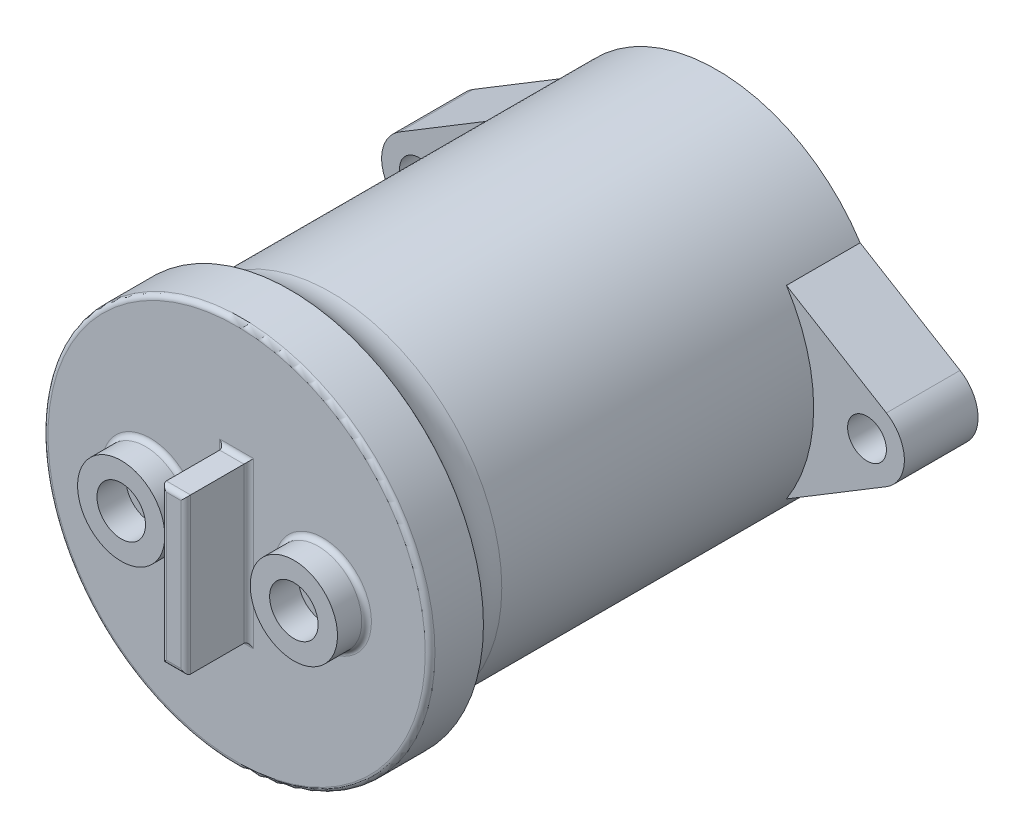
from build123d import *

# Parameters (mm, degrees)
SKETCH2_R           = 17.6
BOSS_EXTRUDE1_DEPTH = 52.5
SKETCH3_R           = 2
BOSS_EXTRUDE2_DEPTH = 7.6
SKETCH4_W           = 2.5
SKETCH4_H           = 16
BOSS_EXTRUDE3_DEPTH = 3.5
CUT_EXTRUDE1_START  = -3
SKETCH5_R           = 17.6
SKETCH5_R_2         = 4.5
SKETCH5_W           = 2.5
SKETCH5_H           = 16
SKETCH5_R_3         = 2.5
CUT_EXTRUDE1_DEPTH  = 3
SKETCH7_R           = 19.95
BOSS_EXTRUDE5_DEPTH = 5.5
FILLET3_R           = 5
FILLET4_R           = 0.5


with BuildPart() as part:
    # Sketch2 → Boss-Extrude1 (new body)
    with BuildSketch(Plane.XY):
        Circle(SKETCH2_R)
    extrude(amount=BOSS_EXTRUDE1_DEPTH)

    # Sketch3 → Boss-Extrude2 (add)
    # profile 1 of 2: a face of its own
    with BuildSketch(Plane.XY):
        with BuildLine():
            Line((-14.793995556, 9.534028294), (-25.095041698, 3.292766105))
            ThreePointArc((-25.095041698, 3.292766105), (-26.95, 0), (-25.095041698, -3.292766105))
            Line((-25.095041698, -3.292766105), (-14.793995556, -9.534028294))
            ThreePointArc((-14.793995556, -9.534028294), (-17.6, 0), (-14.793995556, 9.534028294))
        make_face()
        with Locations(Location((-23.1, 0, 0), (0, 0, 180))):
            Circle(SKETCH3_R, mode=Mode.SUBTRACT)
    # profile 2 of 2: a face of its own
    with BuildSketch(Plane.XY):
        with BuildLine():
            Line((25.095041698, 3.292766105), (14.793995556, 9.534028294))
            ThreePointArc((14.793995556, 9.534028294), (17.6, 0), (14.793995556, -9.534028294))
            Line((14.793995556, -9.534028294), (25.095041698, -3.292766105))
            ThreePointArc((25.095041698, -3.292766105), (26.95, 0), (25.095041698, 3.292766105))
        make_face()
        with Locations(Location((23.1, 0, 0), (0, 0, 180))):
            Circle(SKETCH3_R, mode=Mode.SUBTRACT)
    extrude(amount=BOSS_EXTRUDE2_DEPTH)

    # Sketch4 → Boss-Extrude3 (add)
    with BuildSketch(Plane.XY.offset(52.5)):
        Rectangle(SKETCH4_W, SKETCH4_H)
    extrude(amount=BOSS_EXTRUDE3_DEPTH)

    # Sketch5 → Cut-Extrude1 (cut)
    # profile 1 of 3: a face of its own
    with BuildSketch(Plane.XY.offset(52.5).offset(CUT_EXTRUDE1_START)):
        with Locations(Location((0, 0, 0), (0, 0, 147.200140228))):
            Circle(SKETCH5_R)
        with Locations((-8.9, 0)):
            Circle(SKETCH5_R_2, mode=Mode.SUBTRACT)
        with Locations((8.9, 0)):
            Circle(SKETCH5_R_2, mode=Mode.SUBTRACT)
        Rectangle(SKETCH5_W, SKETCH5_H, mode=Mode.SUBTRACT)
    # profile 2 of 3: a face of its own
    with BuildSketch(Plane.XY.offset(52.5).offset(CUT_EXTRUDE1_START)):
        with Locations((-8.9, 0)):
            Circle(SKETCH5_R_3)
    # profile 3 of 3: a face of its own
    with BuildSketch(Plane.XY.offset(52.5).offset(CUT_EXTRUDE1_START)):
        with Locations((8.9, 0)):
            Circle(SKETCH5_R_3)
    extrude(amount=CUT_EXTRUDE1_DEPTH, mode=Mode.SUBTRACT)

    # Sketch7 → Boss-Extrude5 (add)
    with BuildSketch(Plane.XY.offset(49.5)):
        Circle(SKETCH7_R)
    extrude(amount=-BOSS_EXTRUDE5_DEPTH)

    # Fillet3
    # the kernel refuses this fillet: 5 mm, written as the material it adds along each edge
    with BuildSketch(Plane(origin=(0, 0, 44), x_dir=(1, 0, 0), z_dir=(0, 1, 0))) as fillet3_piece_1:
        with BuildLine():
            CenterArc((22.6, 4.239988208), FILLET3_R, 180, 57.994545172)
            Line((19.95, 0), (19.897, -0.084799764))
            ThreePointArc((19.897, -0.084799764), (18.775, -0.1), (17.6, -0.1))
            Line((17.6, -0.1), (17.5, 0))
            Line((17.5, 0), (17.5, 4.239988208))
            Line((17.5, 4.239988208), (17.6, 4.239988208))
        make_face()
    revolve(axis=Axis((0, 0, 44), (0, 0, -1)))

    # Fillet4
    fillet4_edges = [part.edges().sort_by_distance(p)[0] for p in [
        (1.25, 0, 56),
        (0, 8, 56),
        (0, -8, 56),
        (-1.25, 0, 56),
        (0, 8, 49.5),
        (-1.25, 0, 49.5),
        (0, -8, 49.5),
        (1.25, 0, 49.5),
        (-13.4, 0, 49.5),
        (4.4, 0, 49.5),
        (-19.95, 0, 49.5),
    ]]
    fillet(fillet4_edges, radius=FILLET4_R)


solid = part.part
